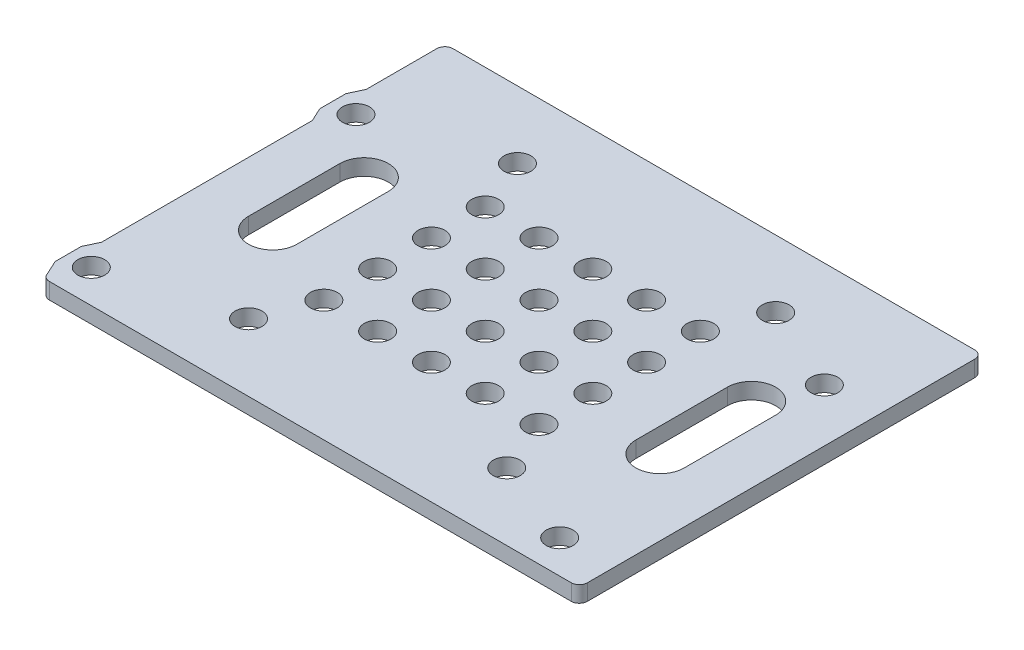
from build123d import *

# Parameters (mm, degrees)
SKETCH_1_W          = 100
SKETCH_1_H          = 75
EXTRUDE_1_DEPTH     = 3
SKETCH_2_R          = 2.5
CUT_EXTRUDE_1_DEPTH = 3
SKETCH_3_R          = 2.5
CUT_EXTRUDE_2_DEPTH = 3
EXTRUDE_2_DEPTH     = 3
FILLET_1_R          = 1.5


with BuildPart() as part:
    # 草图1 → 凸台-拉伸1 (new body)
    with BuildSketch(Plane(origin=(0, 0, 0), x_dir=(1, 0, 0), z_dir=(0, 1, 0))):
        Rectangle(SKETCH_1_W, SKETCH_1_H)
    extrude(amount=EXTRUDE_1_DEPTH)

    # 草图2 → 切除-拉伸1 (cut)
    with BuildSketch(Plane(origin=(0, 3, 0), x_dir=(1, 0, 0), z_dir=(0, 1, 0))):
        with Locations(Location((-46.9, 17.87, 0), (0, 0, 270))):
            Circle(SKETCH_2_R)
        with Locations(Location((-46.9, -31.338, 0), (0, 0, 90))):
            Circle(SKETCH_2_R)
        with Locations(Location((40.184, -31.338, 0), (0, 0, 270))):
            Circle(SKETCH_2_R)
        with Locations(Location((40.184, 17.87, 0), (0, 0, 90))):
            Circle(SKETCH_2_R)
    extrude(amount=-CUT_EXTRUDE_1_DEPTH, mode=Mode.SUBTRACT)

    # 草图3 → 切除-拉伸2 (cut)
    with BuildSketch(Plane(origin=(0, 3, 0), x_dir=(1, 0, 0), z_dir=(0, 1, 0))):
        with Locations(Location((-24, 25, 0), (0, 0, 270))):
            Circle(SKETCH_3_R)
        with Locations(Location((24, 25, 0), (0, 0, 90))):
            Circle(SKETCH_3_R)
        with Locations(Location((24, -25, 0), (0, 0, 270))):
            Circle(SKETCH_3_R)
        with Locations(Location((-24, -25, 0), (0, 0, 90))):
            Circle(SKETCH_3_R)
        with Locations(Location((0, 5, 0), (0, 0, 270))):
            Circle(SKETCH_3_R)
        with Locations(Location((0, 15, 0), (0, 0, 270))):
            Circle(SKETCH_3_R)
        with Locations(Location((0, -15, 0), (0, 0, 90))):
            Circle(SKETCH_3_R)
        with Locations(Location((0, -5, 0), (0, 0, 90))):
            Circle(SKETCH_3_R)
        with Locations(Location((10, 5, 0), (0, 0, 270))):
            Circle(SKETCH_3_R)
        with Locations(Location((10, 15, 0), (0, 0, 270))):
            Circle(SKETCH_3_R)
        with Locations(Location((10, -15, 0), (0, 0, 90))):
            Circle(SKETCH_3_R)
        with Locations(Location((10, -5, 0), (0, 0, 90))):
            Circle(SKETCH_3_R)
        with Locations(Location((20, 5, 0), (0, 0, 270))):
            Circle(SKETCH_3_R)
        with Locations(Location((20, 15, 0), (0, 0, 270))):
            Circle(SKETCH_3_R)
        with Locations(Location((20, -15, 0), (0, 0, 90))):
            Circle(SKETCH_3_R)
        with Locations(Location((20, -5, 0), (0, 0, 90))):
            Circle(SKETCH_3_R)
        with Locations(Location((-20, -5, 0), (0, 0, 270))):
            Circle(SKETCH_3_R)
        with Locations(Location((-20, -15, 0), (0, 0, 270))):
            Circle(SKETCH_3_R)
        with Locations(Location((-20, 15, 0), (0, 0, 90))):
            Circle(SKETCH_3_R)
        with Locations(Location((-20, 5, 0), (0, 0, 90))):
            Circle(SKETCH_3_R)
        with Locations(Location((-10, -5, 0), (0, 0, 270))):
            Circle(SKETCH_3_R)
        with Locations(Location((-10, -15, 0), (0, 0, 270))):
            Circle(SKETCH_3_R)
        with Locations(Location((-10, 15, 0), (0, 0, 90))):
            Circle(SKETCH_3_R)
        with Locations(Location((-10, 5, 0), (0, 0, 90))):
            Circle(SKETCH_3_R)
        with BuildLine():
            Line((-31.51322225, 8.5), (-31.51322225, -8.5))
            ThreePointArc((-31.51322225, -8.5), (-36.01322225, -13), (-40.51322225, -8.5))
            Line((-40.51322225, -8.5), (-40.51322225, 8.5))
            ThreePointArc((-40.51322225, 8.5), (-36.01322225, 13), (-31.51322225, 8.5))
        make_face()
        with BuildLine():
            Line((31.51322225, 8.5), (31.51322225, -8.5))
            ThreePointArc((31.51322225, -8.5), (36.01322225, -13), (40.51322225, -8.5))
            Line((40.51322225, -8.5), (40.51322225, 8.5))
            ThreePointArc((40.51322225, 8.5), (36.01322225, 13), (31.51322225, 8.5))
        make_face()
    extrude(amount=-CUT_EXTRUDE_2_DEPTH, mode=Mode.SUBTRACT)

    # 草图4 → 凸台-拉伸2 (add)
    with BuildSketch(Plane(origin=(0, 3, 0), x_dir=(1, 0, 0), z_dir=(0, 1, 0))):
        Polygon((-50, 22.87), (-51.2, 20.296591695), (-51.2, 15.443408305), (-50, 12.87), align=None)
        Polygon((-51.2, -28.911408305), (-50, -26.338), (-50, -36.338), (-51.2, -33.764591695), align=None)
    extrude(amount=-EXTRUDE_2_DEPTH)

    # 圆角1
    # the kernel refuses this fillet: 1.5 mm, written as the material it takes off along each edge
    with BuildSketch(Plane(origin=(50, -3.75, 37.5), x_dir=(0, 0, -1), z_dir=(0, 1, 0)), Plane(origin=(50, -3.75, -37.5), x_dir=(-1, 0, 0), z_dir=(0, 1, 0))) as fillet_1_piece_1:
        with BuildLine():
            CenterArc((FILLET_1_R, FILLET_1_R), FILLET_1_R, 180, 90)
            Line((0, FILLET_1_R), (-FILLET_1_R * 0.02, FILLET_1_R))
            Line((-FILLET_1_R * 0.02, FILLET_1_R), (-FILLET_1_R * 0.02, -FILLET_1_R * 0.02))
            Line((-FILLET_1_R * 0.02, -FILLET_1_R * 0.02), (FILLET_1_R, -FILLET_1_R * 0.02))
            Line((FILLET_1_R, -FILLET_1_R * 0.02), (FILLET_1_R, 0))
        make_face()
    extrude(amount=10.5, mode=Mode.SUBTRACT)
    with BuildSketch(Plane(origin=(-50, -3.653556486, 37.5), x_dir=(1, 0, 0), z_dir=(0, 1, 0))) as fillet_1_piece_2:
        with BuildLine():
            CenterArc((1.461422595, 1.5), FILLET_1_R, 193.02248013, 76.97751987)
            Line((0, 1.162), (-0.029228452, 1.15524))
            ThreePointArc((-0.029228452, 1.15524), (-0.03, 0.581), (-0.03, 0))
            Line((-0.03, 0), (0, -0.03))
            Line((0, -0.03), (1.461422595, -0.03))
            Line((1.461422595, -0.03), (1.461422595, 0))
        make_face()
    extrude(amount=10.307112973, mode=Mode.SUBTRACT)
    with BuildSketch(Plane(origin=(-50, -3.75, -37.5), x_dir=(1, 0, 0), z_dir=(0, 1, 0))) as fillet_1_piece_3:
        with BuildLine():
            CenterArc((FILLET_1_R, -FILLET_1_R), FILLET_1_R, 90, 90)
            Line((0, -FILLET_1_R), (-FILLET_1_R * 0.02, -FILLET_1_R))
            Line((-FILLET_1_R * 0.02, -FILLET_1_R), (-FILLET_1_R * 0.02, FILLET_1_R * 0.02))
            Line((-FILLET_1_R * 0.02, FILLET_1_R * 0.02), (FILLET_1_R, FILLET_1_R * 0.02))
            Line((FILLET_1_R, FILLET_1_R * 0.02), (FILLET_1_R, 0))
        make_face()
    extrude(amount=10.5, mode=Mode.SUBTRACT)


solid = part.part
